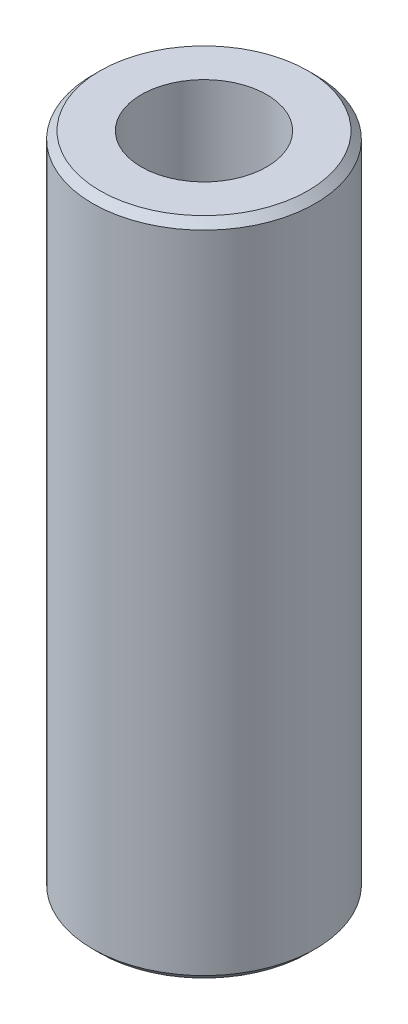
from build123d import *

# Parameters (mm, degrees)
SKETCH1_R           = 12.5
BOSS_EXTRUDE1_DEPTH = 74.137606564
SKETCH2_R           = 7.040646406
CUT_EXTRUDE1_DEPTH  = 77.216039697
CHAMFER1_SIZE       = 0.827467788


with BuildPart() as part:
    # Sketch1 → Boss-Extrude1 (new body)
    with BuildSketch(Plane(origin=(0, 0, 0), x_dir=(1, 0, 0), z_dir=(0, 1, 0))):
        Circle(SKETCH1_R)
    extrude(amount=BOSS_EXTRUDE1_DEPTH)

    # Sketch2 → Cut-Extrude1 (cut, through all)
    with BuildSketch(Plane(origin=(0, 0, 0), x_dir=(1, 0, 0), z_dir=(0, 1, 0))):
        Circle(SKETCH2_R)
    extrude(amount=CUT_EXTRUDE1_DEPTH, mode=Mode.SUBTRACT)

    # Chamfer1
    chamfer1_edges = [part.edges().sort_by_distance(p)[0] for p in [
        (-12.5, 74.137606564, 0),
        (-12.5, 0, 0),
    ]]
    chamfer(chamfer1_edges, length=CHAMFER1_SIZE)


solid = part.part
